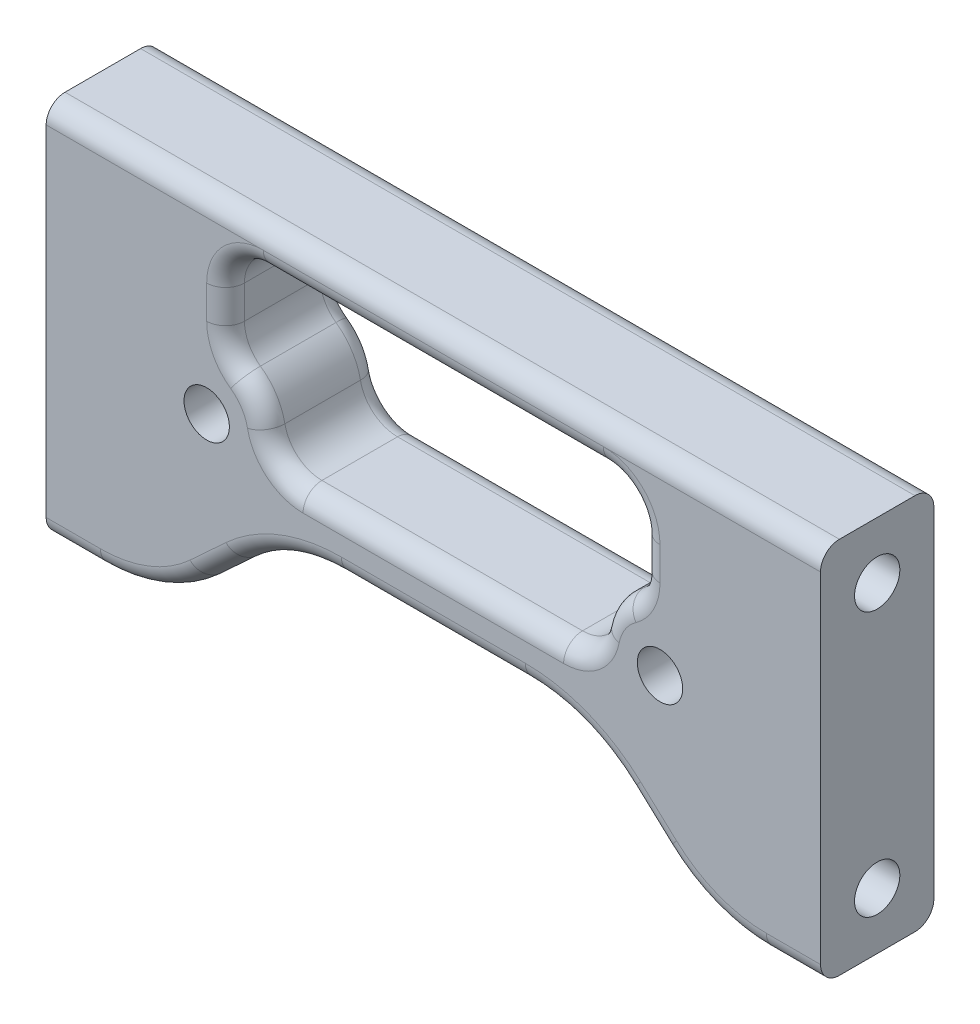
from build123d import *

# Parameters (mm, degrees)
SKETCH1_W           = 65.0875
SKETCH1_H           = 31.75
BOSS_EXTRUDE1_DEPTH = 4.7625
CUT_EXTRUDE1_DEPTH  = 38.441112618
SKETCH3_R           = 1.905
CUT_EXTRUDE2_DEPTH  = 12.7
SKETCH4_R           = 1.905
CUT_EXTRUDE3_DEPTH  = 38.441112618
CUT_EXTRUDE4_DEPTH  = 38.441112618
FILLET3_R           = 3.175
FILLET6_R           = 12.7
FILLET5_R           = 1.5875


# Some blends are built 0.0001 mm under size
with BuildPart() as part:
    # Sketch1 → Boss-Extrude1 (new, symmetric)
    with BuildSketch(Plane.XY):
        Rectangle(SKETCH1_W, SKETCH1_H)
    extrude(amount=BOSS_EXTRUDE1_DEPTH, both=True)

    # Sketch2 → Cut-Extrude1 (cut, through all)
    with BuildSketch(Plane.XY.offset(4.7625)):
        Polygon((-23.01875, -15.875), (-12.7, -6.35), (12.7, -6.35), (23.01875, -15.875), align=None)
    extrude(amount=-CUT_EXTRUDE1_DEPTH, mode=Mode.SUBTRACT)

    # Sketch3 → Cut-Extrude2 (cut)
    with BuildSketch(Plane(origin=(32.54375, 0, 0), x_dir=(0, 0, -1), z_dir=(1, 0, 0))):
        with Locations((0, 11.1125)):
            Circle(SKETCH3_R)
        with Locations((0, -11.1125)):
            Circle(SKETCH3_R)
    cut_extrude2 = extrude(amount=-CUT_EXTRUDE2_DEPTH, mode=Mode.SUBTRACT)

    # Mirror2: Cut-Extrude2 across plane
    add(cut_extrude2.mirror(Plane(origin=(0, 0, 0), x_dir=(0, 0, 1), z_dir=(1, 0, 0))), mode=Mode.SUBTRACT)

    # Sketch4 → Cut-Extrude3 (cut, through all)
    with BuildSketch(Plane(origin=(0, 0, -4.7625), x_dir=(-1, 0, 0), z_dir=(0, 0, -1))):
        with Locations((-19.05, 0)):
            Circle(SKETCH4_R)
        with Locations((19.05, 0)):
            Circle(SKETCH4_R)
    extrude(amount=-CUT_EXTRUDE3_DEPTH, mode=Mode.SUBTRACT)

    # Sketch5 → Cut-Extrude4 (cut, through all)
    with BuildSketch(Plane(origin=(0, 0, -4.7625), x_dir=(-1, 0, 0), z_dir=(0, 0, -1))):
        with BuildLine():
            Line((-14.224417781, -1.5875), (14.224417781, -1.5875))
            ThreePointArc((14.224417781, -1.5875), (14.515266075, 2.289669895), (17.4625, 4.825582219))
            Line((17.4625, 4.825582219), (17.4625, 12.7))
            Line((17.4625, 12.7), (-17.4625, 12.7))
            Line((-17.4625, 12.7), (-17.4625, 4.825582219))
            ThreePointArc((-17.4625, 4.825582219), (-14.515266075, 2.289669895), (-14.224417781, -1.5875))
        make_face()
    extrude(amount=-CUT_EXTRUDE4_DEPTH, mode=Mode.SUBTRACT)

    # Fillet3
    fillet3_edges = [part.edges().sort_by_distance(p)[0] for p in [
        (-17.4625, 4.825582219, 0),
        (-14.224417781, -1.5875, 0),
        (14.224417781, -1.5875, 0),
        (17.4625, 4.825582219, 0),
        (17.4625, 12.7, 0),
        (-17.4625, 12.7, 0),
    ]]
    fillet(fillet3_edges, radius=FILLET3_R)

    # Fillet6
    # the kernel refuses this fillet: 12.7 mm, written as the material it adds along each edge
    with BuildSketch(Plane(origin=(-12.7, -6.35, 4.7625), x_dir=(-0.7348034446274875, -0.6782801027330664, 0), z_dir=(0, 0, -1)), Plane(origin=(12.7, -6.35, 4.7625), x_dir=(-1, 0, 0), z_dir=(0, 0, -1))) as fillet6_piece_1:
        with BuildLine():
            CenterArc((FILLET6_R * 0.390983834413, -FILLET6_R), FILLET6_R, 90, 42.709389957)
            Line((-FILLET6_R * 0.28729626832, -FILLET6_R * 0.265196555373), (0, 0))
            Line((0, 0), (FILLET6_R * 0.390983834413, 0))
        make_face()
    extrude(amount=9.525)
    # the kernel refuses this fillet: 12.7 mm, written as the material it takes off along each edge
    with BuildSketch(Plane(origin=(23.01875, -15.875, 17.176236743), x_dir=(1, 0, 0), z_dir=(0, 0, -1))) as fillet6_2_piece_1:
        with BuildLine():
            CenterArc((FILLET6_R * 0.390983834413, -FILLET6_R), FILLET6_R, 90, 42.709389957)
            Line((-FILLET6_R * 0.28729626832, -FILLET6_R * 0.265196555373), (0, 0))
            Line((0, 0), (FILLET6_R * 0.390983834413, 0))
        make_face()
    extrude(amount=34.352473485, mode=Mode.SUBTRACT)
    with BuildSketch(Plane(origin=(-23.01875, -15.875, 17.176236743), x_dir=(-1, 0, 0), z_dir=(0, 0, -1))) as fillet6_2_piece_2:
        with BuildLine():
            CenterArc((FILLET6_R * 0.390983834413, FILLET6_R), FILLET6_R, 227.290610043, 42.709389957)
            Line((-FILLET6_R * 0.28729626832, FILLET6_R * 0.265196555373), (0, 0))
            Line((0, 0), (FILLET6_R * 0.390983834413, 0))
        make_face()
    extrude(amount=34.352473485, mode=Mode.SUBTRACT)

    # Fillet5
    fillet5_edges = [part.edges().sort_by_distance(p)[0] for p in [
        (0, -1.5875, 4.7625),
        (-16.53256403, 11.77006403, -4.7625),
        (-16.53256403, 11.77006403, 4.7625),
        (-17.106752578, 5.282383875, -4.7625),
        (-17.106752578, 5.282383875, 4.7625),
        (17.106752578, 5.282383875, -4.7625),
        (17.106752578, 5.282383875, 4.7625),
        (16.53256403, 11.77006403, -4.7625),
        (16.53256403, 11.77006403, 4.7625),
        (12.966759515, -0.863949238, -4.7625),
        (12.966759515, -0.863949238, 4.7625),
        (-12.966759515, -0.863949238, -4.7625),
        (-12.966759515, -0.863949238, 4.7625),
        (-17.859375, -11.1125, 4.7625),
        (0, -6.35, 4.7625),
        (17.859375, -11.1125, 4.7625),
        (30.263997349, -15.875, 4.7625),
        (23.359660801, -15.003069318, 4.7625),
        (-23.359660801, -15.003069318, 4.7625),
        (-17.859375, -11.1125, -4.7625),
        (30.263997349, -15.875, -4.7625),
        (17.859375, -11.1125, -4.7625),
        (0, -6.35, -4.7625),
        (23.359660801, -15.003069318, -4.7625),
        (-23.359660801, -15.003069318, -4.7625),
        (-12.359089199, -7.221930682, 4.7625),
        (-12.359089199, -7.221930682, -4.7625),
        (12.359089199, -7.221930682, 4.7625),
        (12.359089199, -7.221930682, -4.7625),
        (-30.263997349, -15.875, 4.7625),
        (-30.263997349, -15.875, -4.7625),
        (0, 15.875, -4.7625),
        (0, 12.7, -4.7625),
        (0, 12.7, 4.7625),
        (0, 15.875, 4.7625),
        (-17.4625, 8.133835742, -4.7625),
        (-17.4625, 8.133835742, 4.7625),
        (-14.786009483, 2.7613013, -4.7625),
        (-14.786009483, 2.7613013, 4.7625),
        (14.786009483, 2.7613013, -4.7625),
        (14.786009483, 2.7613013, 4.7625),
        (17.4625, 8.133835742, -4.7625),
        (17.4625, 8.133835742, 4.7625),
        (0, -1.5875, -4.7625),
    ]]
    fillet(fillet5_edges, radius=FILLET5_R - 0.0001)  # a hair under: the kernel refuses the full size


solid = part.part
